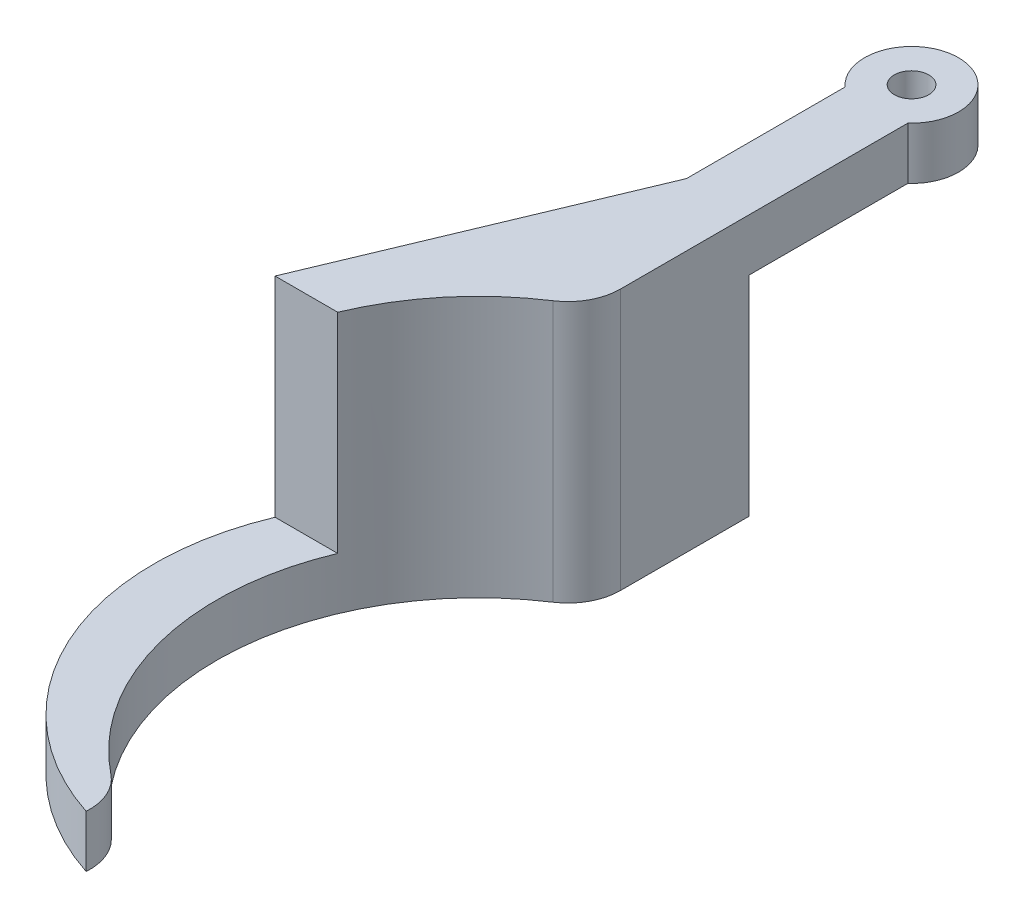
from build123d import *

# Parameters (mm, degrees)
EXTRUDE_2_DEPTH     = 5
SKETCH_4_R          = 1.65
CUT_EXTRUDE_1_DEPTH = 5
EXTRUDE_3_DEPTH     = 5
CUT_EXTRUDE_START   = -4.5
SKETCH_7_R          = 3
CUT_EXTRUDE_2_DEPTH = 3
CUT_EXTRUDE_3_DEPTH = 7.5
EXTRUDE_4_DEPTH     = 5
FILLET_1_R          = 5
FILLET_2_R          = 5
EXTRUDE_5_DEPTH     = 15
EXTRUDE_6_DEPTH     = 5
CUT_EXTRUDE_START_2 = -5
CUT_EXTRUDE_4_DEPTH = 5


with BuildPart() as part:
    # 草图3 → 凸台-拉伸2 (new body)
    with BuildSketch(Plane(origin=(0, 0, 0), x_dir=(1, 0, 0), z_dir=(0, 1, 0))):
        with BuildLine():
            Line((-3, -3.354101966), (-3, -7.416198487))
            Line((-3, -7.416198487), (-3, -43.854101966))
            Line((-3, -43.854101966), (3, -43.854101966))
            Line((3, -43.854101966), (3, -10.583005244))
            Line((3, -10.583005244), (3, -7.416198487))
            Line((3, -7.416198487), (3, -3.354101966))
            ThreePointArc((3, -3.354101966), (0, 4.5), (-3, -3.354101966))
        make_face()
    extrude(amount=EXTRUDE_2_DEPTH)

    # 草图4 → 切除-拉伸1 (cut)
    with BuildSketch(Plane(origin=(0, 5, 0), x_dir=(1, 0, 0), z_dir=(0, 1, 0))):
        with Locations(Location((0, 0, 0), (0, 0, 270))):
            Circle(SKETCH_4_R)
    extrude(amount=-CUT_EXTRUDE_1_DEPTH, mode=Mode.SUBTRACT)

    # 草图6 → 凸台-拉伸3 (add)
    with BuildSketch(Plane(origin=(0, 5, 0), x_dir=(1, 0, 0), z_dir=(0, 1, 0))):
        with BuildLine():
            Line((3, -33.74604712), (-3, -33.74604712))
            ThreePointArc((-3, -33.74604712), (-16.46902092, -57.986607816), (0.722500961, -79.745993902))
            Line((0.722500961, -79.745993902), (1.949520222, -77.620734201))
            ThreePointArc((1.949520222, -77.620734201), (-10.543317179, -55.371702353), (3, -33.74604712))
        make_face()
    extrude(amount=-EXTRUDE_3_DEPTH)

    # 草图7 → 切除-拉伸2 (cut)
    with BuildSketch(Plane(origin=(0, 5, 0), x_dir=(1, 0, 0), z_dir=(0, 1, 0)).offset(CUT_EXTRUDE_START)):
        with Locations(Location((0, 0, 0), (0, 0, 270))):
            Circle(SKETCH_7_R)
    extrude(amount=-CUT_EXTRUDE_2_DEPTH, mode=Mode.SUBTRACT)

    # 草图8 → 切除-拉伸3 (cut)
    with BuildSketch(Plane(origin=(0, 5, 0), x_dir=(1, 0, 0), z_dir=(0, 1, 0))):
        with BuildLine():
            Line((-3, -38.067187498), (-3, -43.854101966))
            Line((-3, -43.854101966), (3, -43.854101966))
            Line((3, -43.854101966), (3, -33.74604712))
            ThreePointArc((3, -33.74604712), (-0.160637142, -35.683569047), (-3, -38.067187498))
        make_face()
    extrude(amount=-CUT_EXTRUDE_3_DEPTH, mode=Mode.SUBTRACT)

    # 草图9 → 凸台-拉伸4 (add)
    with BuildSketch(Plane(origin=(0, 5, 0), x_dir=(1, 0, 0), z_dir=(0, 1, 0))):
        with BuildLine():
            Line((-3, -18.550074543), (-14.614967684, -46.324924269))
            ThreePointArc((-14.614967684, -46.324924269), (-9.917875534, -39.010182445), (-3, -33.74604712))
            Line((-3, -33.74604712), (-3, -18.550074543))
        make_face()
    extrude(amount=-EXTRUDE_4_DEPTH)

    # 圆角1
    fillet_1_edges = [part.edges().sort_by_distance(p)[0] for p in [
        (3, 2.5, 33.74604712),
    ]]
    fillet(fillet_1_edges, radius=FILLET_1_R)

    # 圆角2
    # the kernel refuses this fillet: 5 mm, written as the material it takes off along each edge
    with BuildSketch(Plane(origin=(1.949520222, 14.371610933, 77.620734201), x_dir=(-0.8261015944022844, 0, -0.5635212114250925), z_dir=(0, -1, 0))) as fillet_2_piece_1:
        with BuildLine():
            CenterArc((4.123508811, -4.985927863), FILLET_2_R, 94.299664485, 55.185648669)
            Line((-0.183986354, -2.447131808), (-0.270136257, -2.396355887))
            ThreePointArc((-0.270136257, -2.396355887), (-0.191711734, -1.216068615), (-0.099718557, 0.007497289))
            Line((-0.099718557, 0.007497289), (0.007497289, 0.099718557))
            ThreePointArc((0.007497289, 0.099718557), (1.874322187, 0.029639314), (3.741147084, 0.099718557))
            Line((3.741147084, 0.099718557), (3.748644373, 0))
        make_face()
    extrude(amount=23.743221866, mode=Mode.SUBTRACT)

    # 草图10 → 凸台-拉伸5 (add)
    with BuildSketch(Plane.XZ):
        with BuildLine():
            Line((-3, 18.550074543), (3, 18.550074543))
            Line((3, 18.550074543), (3, 30.881988685))
            ThreePointArc((3, 30.881988685), (2.399314351, 33.25812699), (0.741586704, 35.063340422))
            ThreePointArc((0.741586704, 35.063340422), (-4.779586935, 39.993821756), (-8.614967684, 46.324924269))
            Line((-8.614967684, 46.324924269), (-14.614967684, 46.324924269))
            Line((-14.614967684, 46.324924269), (-3, 18.550074543))
        make_face()
    extrude(amount=EXTRUDE_5_DEPTH)

    # 草图11 → 凸台-拉伸6 (add)
    with BuildSketch(Plane.XZ.offset(15)):
        with BuildLine():
            Line((-14.614967684, 46.324924269), (-3, 18.550074543))
            Line((-3, 18.550074543), (3, 18.550074543))
            Line((3, 18.550074543), (3, 30.881988685))
            ThreePointArc((3, 30.881988685), (2.399314351, 33.25812699), (0.741586704, 35.063340422))
            ThreePointArc((0.741586704, 35.063340422), (-4.779586935, 39.993821756), (-8.614967684, 46.324924269))
            ThreePointArc((-8.614967684, 46.324924269), (-9.770106213, 62.167654699), (-1.147240872, 75.508293582))
            ThreePointArc((-1.147240872, 75.508293582), (0.307928877, 77.397579493), (0.722500961, 79.745993902))
            ThreePointArc((0.722500961, 79.745993902), (-14.272081884, 66.397409294), (-14.614967684, 46.324924269))
        make_face()
    extrude(amount=EXTRUDE_6_DEPTH)

    # 草图12 → 切除-拉伸4 (cut)
    with BuildSketch(Plane.XZ.offset(CUT_EXTRUDE_START_2)):
        with BuildLine():
            Line((-14.614967684, 46.324924269), (-8.614967684, 46.324924269))
            ThreePointArc((-8.614967684, 46.324924269), (-9.770106213, 62.167654699), (-1.147240872, 75.508293582))
            ThreePointArc((-1.147240872, 75.508293582), (0.307928877, 77.397579493), (0.722500961, 79.745993902))
            ThreePointArc((0.722500961, 79.745993902), (-14.272081884, 66.397409294), (-14.614967684, 46.324924269))
        make_face()
    extrude(amount=CUT_EXTRUDE_4_DEPTH, mode=Mode.SUBTRACT)


solid = part.part
